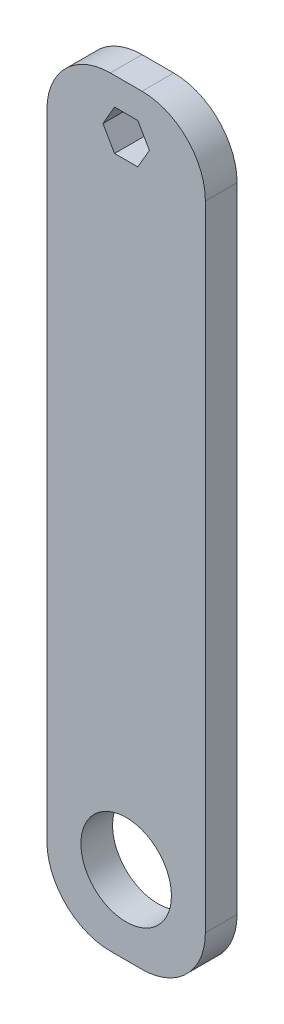
from build123d import *

# Parameters (mm, degrees)
SKETCH1_W           = 50
SKETCH1_H           = 10
BOSS_EXTRUDE1_DEPTH = 120
SKETCH2_R           = 14.2875
CUT_EXTRUDE1_DEPTH  = 127
FILLET1_R           = 20


with BuildPart() as part:
    # Sketch1 → Boss-Extrude1 (new, symmetric)
    with BuildSketch(Plane(origin=(0, 0, 0), x_dir=(1, 0, 0), z_dir=(0, 1, 0))):
        Rectangle(SKETCH1_W, SKETCH1_H)
    extrude(amount=BOSS_EXTRUDE1_DEPTH, both=True)

    # Sketch2 → Cut-Extrude1 (cut)
    with BuildSketch(Plane.XY.offset(5)):
        with Locations((0, -95.26)):
            Circle(SKETCH2_R)
        Polygon((3.666174209, 98.65), (7.332348419, 105), (3.666174209, 111.35), (-3.666174209, 111.35), (-7.332348419, 105), (-3.666174209, 98.65), align=None)
    extrude(amount=-CUT_EXTRUDE1_DEPTH, mode=Mode.SUBTRACT)

    # Fillet1
    fillet1_edges = [part.edges().sort_by_distance(p)[0] for p in [
        (-25, -120, 0),
        (25, -120, 0),
        (25, 120, 0),
        (-25, 120, 0),
    ]]
    fillet(fillet1_edges, radius=FILLET1_R)


solid = part.part
